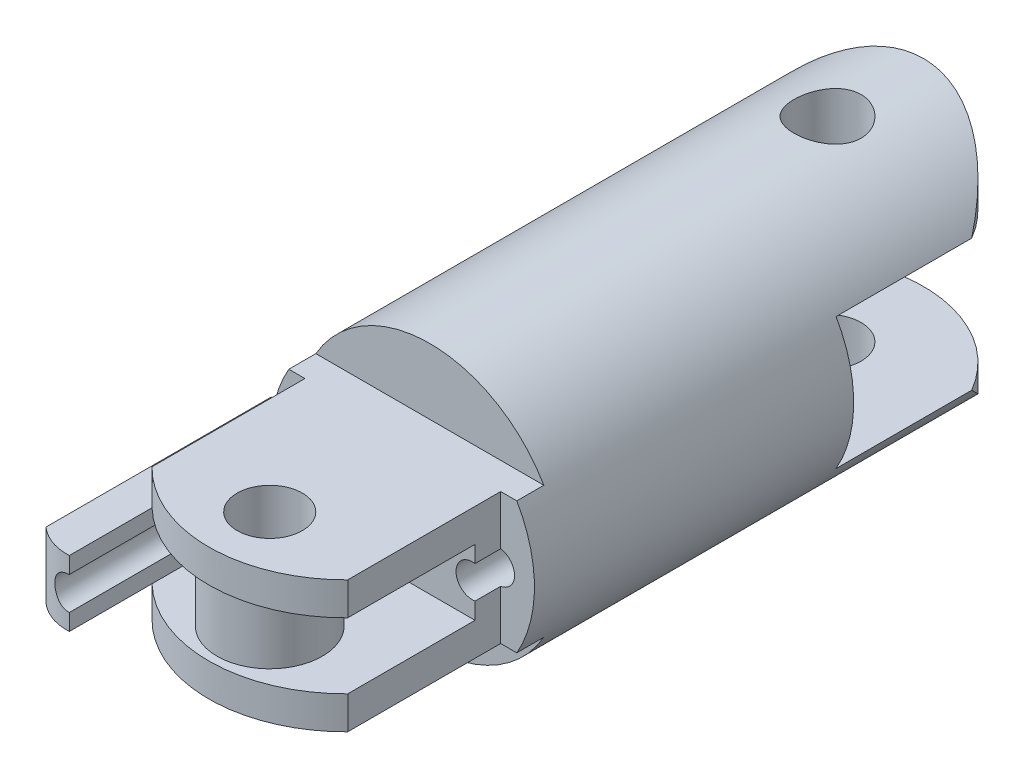
from build123d import *
from build123d.topology import SkipClean

# Parameters (mm, degrees)
SKETCH2_R                       = 10
PHALANGE_LENGTH_DEPTH           = 26.2
BOSS_EXTRUDE3_DEPTH             = 5
BOSS_EXTRUDE4_DEPTH             = 5
BOSS_EXTRUDE4_DEPTH_BACK        = 5
CUT_EXTRUDE2_START              = -15.3025
CUT_EXTRUDE2_DEPTH              = 15.3025
SKETCH7_R                       = 1.65
CUT_EXTRUDE3_DEPTH              = 10
CUT_EXTRUDE4_DEPTH              = 2.5
CUT_EXTRUDE4_DEPTH_BACK         = 2.5
CUT_EXTRUDE7_REACH              = 47.294
SKETCH4_R                       = 1.65
CUT_EXTRUDE7_DIRECTION_2_REACH  = 47.294
CUT_EXTRUDE_THIN1_START         = 26.2
CUT_EXTRUDE_THIN1_DEPTH         = 10.361670454
BOSS_EXTRUDE5_REACH             = 46.529
SKETCH9_R                       = 4
SKETCH9_R_2                     = 1.65
CUT_EXTRUDE8_REACH              = 45.846
SKETCH10_R                      = 1.25
CUT_EXTRUDE9_START              = -4
CUT_EXTRUDE9_DEPTH              = 4
CUT_EXTRUDE10_REACH             = 46.529
CUT_EXTRUDE10_DIRECTION_2_REACH = 46.529
CUT_EXTRUDE11_START             = -10
CUT_EXTRUDE11_OUTLINE_W         = 2.565773848
CUT_EXTRUDE11_OUTLINE_H         = 11.6166929
CUT_EXTRUDE11_DEPTH             = 10
BOSS_EXTRUDE7_REACH             = 44.149
CUT_EXTRUDE12_REACH             = 45.846
SKETCH10_2_R                    = 1.25
CUT_EXTRUDE12_DIRECTION_2_REACH = 45.846
SKETCH17_R                      = 1.25
SKETCH17_W                      = 2.42123439
SKETCH17_H                      = 5
CUT_EXTRUDE14_DEPTH             = 16.148519
SCALE1_SCALE                    = 0.666666667
CUT_EXTRUDE15_START             = -10.000004
SKETCH18_R                      = 1.65
CUT_EXTRUDE15_DEPTH             = 13.333342
CUT_EXTRUDE16_START             = -3.333333
SKETCH19_R                      = 1.7
CUT_EXTRUDE16_DEPTH             = 13.333338


# Read off the part's stored shape, not the designer's step: Cut-Extrude-Thin1, Cut-Extrude11
with BuildPart() as part:
    # Sketch2 → Phalange Length (new body)
    with BuildSketch(Plane.XY):
        Circle(SKETCH2_R)
    extrude(amount=PHALANGE_LENGTH_DEPTH)

    # Sketch3 → Boss-Extrude3 (add)
    with BuildSketch(Plane(origin=(0, -10, 0), x_dir=(-1, 0, 0), z_dir=(0, -1, 0))):
        with BuildLine():
            Line((-10, 5.302499701), (-10, 0))
            Line((-10, 0), (10, 0))
            Line((10, 0), (10, 5.302499701))
            ThreePointArc((10, 5.302499701), (0, 15.302499701), (-10, 5.302499701))
        make_face()
    boss_extrude3 = extrude(amount=-BOSS_EXTRUDE3_DEPTH)

    # Mirror1: Boss-Extrude3 across plane
    add(boss_extrude3.mirror(Plane.ZX))

    # Sketch5 → Boss-Extrude4 (add, two sides: drawn at the far end of the back side and taken through both)
    with BuildSketch(Plane(origin=(0, 0, 0), x_dir=(1, 0, 0), z_dir=(0, 1, 0)).offset(-BOSS_EXTRUDE4_DEPTH_BACK)):
        with BuildLine():
            Line((-10, -31.983157911), (-10, -26.2))
            Line((-10, -26.2), (10, -26.2))
            Line((10, -26.2), (10, -31.983157911))
            ThreePointArc((10, -31.983157911), (0, -41.551984156), (-10, -31.983157911))
        make_face()
    extrude(amount=BOSS_EXTRUDE4_DEPTH + BOSS_EXTRUDE4_DEPTH_BACK)

    # Sketch6 → Cut-Extrude2 (cut)
    with SkipClean():  # the faces are left unmerged after this step: merging them gives an invalid solid
        with BuildSketch(Plane.XY.offset(CUT_EXTRUDE2_START)):
            with BuildLine():
                ThreePointArc((0, 10), (5, 8.660254038), (8.660254038, 5))
                Line((8.660254038, 5), (10, 5))
                Line((10, 5), (10, 10))
                Line((10, 10), (0, 10))
            make_face()
            with BuildLine():
                Line((10, -5), (8.660254038, -5))
                ThreePointArc((8.660254038, -5), (5, -8.660254038), (0, -10))
                Line((0, -10), (10, -10))
                Line((10, -10), (10, -5))
            make_face()
            with BuildLine():
                ThreePointArc((-8.660254038, 5), (-5, 8.660254038), (0, 10))
                Line((0, 10), (-10, 10))
                Line((-10, 10), (-10, 5))
                Line((-10, 5), (-8.660254038, 5))
            make_face()
            with BuildLine():
                Line((-10, -10), (0, -10))
                ThreePointArc((0, -10), (-5, -8.660254038), (-8.660254038, -5))
                Line((-8.660254038, -5), (-10, -5))
                Line((-10, -5), (-10, -10))
            make_face()
        extrude(amount=CUT_EXTRUDE2_DEPTH, mode=Mode.SUBTRACT)

    # Sketch7 → Cut-Extrude3 (cut)
    with SkipClean():  # the faces are left unmerged after this step: merging them gives an invalid solid
        with BuildSketch(Plane(origin=(0, 5, 0), x_dir=(1, 0, 0), z_dir=(0, 1, 0))):
            with Locations(Location((0, -34.361984156, 0), (0, 0, 270))):
                Circle(SKETCH7_R)
        extrude(amount=-CUT_EXTRUDE3_DEPTH, mode=Mode.SUBTRACT)

    # Sketch5<2> → Cut-Extrude4 (cut, two sides: drawn at the far end of the back side and taken through both)
    with BuildSketch(Plane(origin=(0, 0, 0), x_dir=(1, 0, 0), z_dir=(0, 1, 0)).offset(-CUT_EXTRUDE4_DEPTH_BACK)):
        with BuildLine():
            Line((-10, -31.983157911), (-10, -26.2))
            Line((-10, -26.2), (10, -26.2))
            Line((10, -26.2), (10, -31.983157911))
            ThreePointArc((10, -31.983157911), (0, -41.551984156), (-10, -31.983157911))
        make_face()
    extrude(amount=CUT_EXTRUDE4_DEPTH + CUT_EXTRUDE4_DEPTH_BACK, mode=Mode.SUBTRACT)

    # Sketch4 → Cut-Extrude7 (cut, up to next)
    with BuildSketch(Plane(origin=(0, -5, 0), x_dir=(1, 0, 0), z_dir=(0, 1, 0)), mode=Mode.PRIVATE) as cut_extrude7_sk1:
        with Locations(Location((0, 8.010159673, 0), (0, 0, 270))):
            Circle(SKETCH4_R)
    cut_extrude7_tool1 = extrude(cut_extrude7_sk1.sketch, amount=-CUT_EXTRUDE7_REACH, mode=Mode.PRIVATE) & part.part
    add(cut_extrude7_tool1.solids().sort_by_distance((0, -5, -8.01016))[0], mode=Mode.SUBTRACT)

    # Sketch4 → Cut-Extrude7 direction 2 (cut, up to next)
    with BuildSketch(Plane(origin=(0, -5, 0), x_dir=(1, 0, 0), z_dir=(0, 1, 0)), mode=Mode.PRIVATE) as cut_extrude7_direction_2_sk1:
        with Locations(Location((0, 8.010159673, 0), (0, 0, 270))):
            Circle(SKETCH4_R)
    cut_extrude7_direction_2_tool1 = extrude(cut_extrude7_direction_2_sk1.sketch, amount=CUT_EXTRUDE7_DIRECTION_2_REACH, mode=Mode.PRIVATE) & part.part
    add(cut_extrude7_direction_2_tool1.solids().sort_by_distance((0, -5, -8.01016))[0], mode=Mode.SUBTRACT)

    # Cut-Extrude-Thin1 outline → Cut-Extrude-Thin1 (cut)
    with SkipClean():  # the faces are left unmerged after this step: merging them gives an invalid solid
        with BuildSketch(Plane.XY.offset(CUT_EXTRUDE_THIN1_START)):
            with BuildLine():
                ThreePointArc((8.660254038, 5), (9.256147934, 3.78466979), (9.682458366, 2.5))
                Line((9.682458366, 2.5), (10, 2.5))
                Line((10, 2.5), (10, 5))
                Line((10, 5), (8.660254038, 5))
            make_face()
            with BuildLine():
                Line((10, -2.5), (9.682458366, -2.5))
                ThreePointArc((9.682458366, -2.5), (9.256147934, -3.78466979), (8.660254038, -5))
                Line((8.660254038, -5), (10, -5))
                Line((10, -5), (10, -2.5))
            make_face()
            with BuildLine():
                Line((-10, 2.5), (-9.682458366, 2.5))
                ThreePointArc((-9.682458366, 2.5), (-9.256147934, 3.78466979), (-8.660254038, 5))
                Line((-8.660254038, 5), (-10, 5))
                Line((-10, 5), (-10, 2.5))
            make_face()
            with BuildLine():
                ThreePointArc((-8.660254038, -5), (-9.256147934, -3.78466979), (-9.682458366, -2.5))
                Line((-9.682458366, -2.5), (-10, -2.5))
                Line((-10, -2.5), (-10, -5))
                Line((-10, -5), (-8.660254038, -5))
            make_face()
        extrude(amount=CUT_EXTRUDE_THIN1_DEPTH, mode=Mode.SUBTRACT)

    # Sketch9 → Boss-Extrude5 (add, up to next)
    with BuildSketch(Plane.XZ.offset(-2.5), mode=Mode.PRIVATE) as boss_extrude5_sk1:
        with Locations(Location((0, 34.361984156, 0), (0, 0, 90))):
            Circle(SKETCH9_R)
        with Locations(Location((0, 34.361984156, 0), (0, 0, 90))):
            Circle(SKETCH9_R_2, mode=Mode.SUBTRACT)
    boss_extrude5_tool1 = extrude(boss_extrude5_sk1.sketch, amount=BOSS_EXTRUDE5_REACH, mode=Mode.PRIVATE) - part.part
    add(boss_extrude5_tool1.solids().sort_by_distance((0, 2.5, 30.475121))[0])

    # Sketch10 → Cut-Extrude8 (cut, up to next)
    with BuildSketch(Plane.XY.offset(26.2), mode=Mode.PRIVATE) as cut_extrude8_sk1:
        with Locations((7.239961745, 0)):
            Circle(SKETCH10_R)
    cut_extrude8_tool1 = extrude(cut_extrude8_sk1.sketch, amount=-CUT_EXTRUDE8_REACH, mode=Mode.PRIVATE) & part.part
    # Sketch10 → Cut-Extrude8 (cut, up to next)
    with BuildSketch(Plane.XY.offset(26.2), mode=Mode.PRIVATE) as cut_extrude8_sk2:
        with Locations((-7.239961745, 0)):
            Circle(SKETCH10_R)
    cut_extrude8_tool2 = extrude(cut_extrude8_sk2.sketch, amount=-CUT_EXTRUDE8_REACH, mode=Mode.PRIVATE) & part.part
    add(cut_extrude8_tool1.solids().sort_by_distance((7.239962, 0, 26.2))[0], mode=Mode.SUBTRACT)
    add(cut_extrude8_tool2.solids().sort_by_distance((-7.239962, 0, 26.2))[0], mode=Mode.SUBTRACT)

    # Sketch11 → Cut-Extrude9 (cut)
    with SkipClean():  # the faces are left unmerged after this step: merging them gives an invalid solid
        with BuildSketch(Plane.XY.offset(26.2).offset(CUT_EXTRUDE9_START)):
            with BuildLine():
                ThreePointArc((8.660254038, 5), (0, 10), (-8.660254038, 5))
                Line((-8.660254038, 5), (8.660254038, 5))
            make_face()
            with BuildLine():
                Line((8.660254038, -5), (-8.660254038, -5))
                ThreePointArc((-8.660254038, -5), (0, -10), (8.660254038, -5))
            make_face()
        extrude(amount=CUT_EXTRUDE9_DEPTH, mode=Mode.SUBTRACT)

    # Sketch12 → Cut-Extrude10 (cut, up to next)
    with BuildSketch(Plane.XZ.offset(-2.5), mode=Mode.PRIVATE) as cut_extrude10_sk1:
        with BuildLine():
            Line((-10.033719202, 41.551984156), (-10.033719202, 34.364892021))
            Line((-10.033719202, 34.364892021), (-8.660254038, 34.364892021))
            ThreePointArc((-8.660254038, 34.364892021), (0, 38.990740593), (8.660254038, 34.364892021))
            Line((8.660254038, 34.364892021), (10.033719202, 34.364892021))
            Line((10.033719202, 34.364892021), (10.033719202, 41.551984156))
            Line((10.033719202, 41.551984156), (-10.033719202, 41.551984156))
        make_face()
    cut_extrude10_tool1 = extrude(cut_extrude10_sk1.sketch, amount=CUT_EXTRUDE10_REACH, mode=Mode.PRIVATE) & part.part
    add(cut_extrude10_tool1.solids().sort_by_distance((0, 2.5, 39.050279))[0], mode=Mode.SUBTRACT)

    # Sketch12 → Cut-Extrude10 direction 2 (cut, up to next)
    with BuildSketch(Plane.XZ.offset(-2.5), mode=Mode.PRIVATE) as cut_extrude10_direction_2_sk1:
        with BuildLine():
            Line((-10.033719202, 41.551984156), (-10.033719202, 34.364892021))
            Line((-10.033719202, 34.364892021), (-8.660254038, 34.364892021))
            ThreePointArc((-8.660254038, 34.364892021), (0, 38.990740593), (8.660254038, 34.364892021))
            Line((8.660254038, 34.364892021), (10.033719202, 34.364892021))
            Line((10.033719202, 34.364892021), (10.033719202, 41.551984156))
            Line((10.033719202, 41.551984156), (-10.033719202, 41.551984156))
        make_face()
    cut_extrude10_direction_2_tool1 = extrude(cut_extrude10_direction_2_sk1.sketch, amount=-CUT_EXTRUDE10_DIRECTION_2_REACH, mode=Mode.PRIVATE) & part.part
    add(cut_extrude10_direction_2_tool1.solids().sort_by_distance((0, 2.5, 39.050279))[0], mode=Mode.SUBTRACT)

    # Cut-Extrude11 outline → Cut-Extrude11 (cut)
    with BuildSketch(Plane.XZ.offset(5).offset(CUT_EXTRUDE11_START)):
        with Locations((-8.717113076, 30.060571369)):
            Rectangle(CUT_EXTRUDE11_OUTLINE_W, CUT_EXTRUDE11_OUTLINE_H)
        with Locations((8.717113076, 30.060571369)):
            Rectangle(CUT_EXTRUDE11_OUTLINE_W, CUT_EXTRUDE11_OUTLINE_H)
    extrude(amount=CUT_EXTRUDE11_DEPTH, mode=Mode.SUBTRACT)

    # Boss-Extrude7: up to this face of the body (flat: up to its plane)
    boss_extrude7_end = Plane(part.part.faces().sort_by_distance((0, 2.5, 26.396174341))[0])
    # Sketch16 → Boss-Extrude7 (add, up to the picked face)
    with BuildSketch(Plane(origin=(0, -2.5, 0), x_dir=(1, 0, 0), z_dir=(0, 1, 0)), mode=Mode.PRIVATE) as boss_extrude7_sk1:
        with BuildLine():
            Line((-4.818727355, -24.252224919), (-7.434226152, -24.252224919))
            Line((-7.434226152, -24.252224919), (-10, -24.252224919))
            Line((-10, -24.252224919), (-10, -41.358561033))
            ThreePointArc((-10, -41.358561033), (-8.808295471, -42.090817912), (-7.43422564, -42.352145139))
            ThreePointArc((-7.43422564, -42.352145139), (-6.033645007, -42.099721533), (-4.818727355, -41.358561033))
            Line((-4.818727355, -41.358561033), (-4.818727355, -37.809527951))
            ThreePointArc((-4.818727355, -37.809527951), (-6.204248493, -36.942230104), (-7.437080645, -35.868917819))
            Line((-7.437080645, -35.868917819), (-7.434226152, -35.868917819))
            Line((-7.434226152, -35.868917819), (-7.434226152, -26.2))
            Line((-7.434226152, -26.2), (-4.818727355, -26.2))
            Line((-4.818727355, -26.2), (-4.818727355, -24.252224919))
        make_face()
    boss_extrude7_tool1 = split(extrude(boss_extrude7_sk1.sketch, amount=BOSS_EXTRUDE7_REACH, mode=Mode.PRIVATE), bisect_by=boss_extrude7_end, keep=Keep.BOTH, mode=Mode.PRIVATE)
    # Sketch16 → Boss-Extrude7 (add, up to the picked face)
    with BuildSketch(Plane(origin=(0, -2.5, 0), x_dir=(1, 0, 0), z_dir=(0, 1, 0)), mode=Mode.PRIVATE) as boss_extrude7_sk2:
        with BuildLine():
            Line((-4.818727355, -37.809527951), (-4.818727355, -26.2))
            Line((-4.818727355, -26.2), (-7.434226152, -26.2))
            Line((-7.434226152, -26.2), (-7.434226152, -35.868917819))
            Line((-7.434226152, -35.868917819), (-7.437080645, -35.868917819))
            ThreePointArc((-7.437080645, -35.868917819), (-6.204248493, -36.942230104), (-4.818727355, -37.809527951))
        make_face()
    boss_extrude7_tool2 = split(extrude(boss_extrude7_sk2.sketch, amount=BOSS_EXTRUDE7_REACH, mode=Mode.PRIVATE), bisect_by=boss_extrude7_end, keep=Keep.BOTH, mode=Mode.PRIVATE)
    add(boss_extrude7_tool1.solids().sort_by(Axis((-7.989429, -2.5, 33.833344), (0, 1, 0)))[0])
    add(boss_extrude7_tool2.solids().sort_by(Axis((-6.08748, -2.5, 31.5879), (0, 1, 0)))[0])

    # Sketch10<2> → Cut-Extrude12 (cut, up to next)
    with BuildSketch(Plane.XY.offset(26.2), mode=Mode.PRIVATE) as cut_extrude12_sk1:
        with Locations((-7.239961745, 0)):
            Circle(SKETCH10_2_R)
    cut_extrude12_tool1 = extrude(cut_extrude12_sk1.sketch, amount=CUT_EXTRUDE12_REACH, mode=Mode.PRIVATE) & part.part
    add(cut_extrude12_tool1.solids().sort_by_distance((-7.239962, 0, 26.2))[0], mode=Mode.SUBTRACT)

    # Sketch10<2> → Cut-Extrude12 direction 2 (cut, up to next)
    with BuildSketch(Plane.XY.offset(26.2), mode=Mode.PRIVATE) as cut_extrude12_direction_2_sk1:
        with Locations((-7.239961745, 0)):
            Circle(SKETCH10_2_R)
    cut_extrude12_direction_2_tool1 = extrude(cut_extrude12_direction_2_sk1.sketch, amount=-CUT_EXTRUDE12_DIRECTION_2_REACH, mode=Mode.PRIVATE) & part.part
    add(cut_extrude12_direction_2_tool1.solids().sort_by_distance((-7.239962, 0, 26.2))[0], mode=Mode.SUBTRACT)

    # Sketch17 → Cut-Extrude14 (cut)
    with SkipClean():  # the faces are left unmerged after this step: merging them gives an invalid solid
        with BuildSketch(Plane.XY.offset(26.2)):
            with Locations((-7.239961745, 0)):
                Circle(SKETCH17_R)
            with Locations((-6.02934455, 0)):
                Rectangle(SKETCH17_W, SKETCH17_H)
        extrude(amount=CUT_EXTRUDE14_DEPTH, mode=Mode.SUBTRACT)


with BuildPart() as part_1:
    # Scale1: scaled about (-0.170628715, -1.58e-07, 11.526321464)
    add(part.part.scale(SCALE1_SCALE).moved(Location((-0.056876238, -5.3e-08, 3.842107155))))

    # Sketch18 → Cut-Extrude15 (cut)
    with BuildSketch(Plane(origin=(0, 3.333328658, 0), x_dir=(1, 0, 0), z_dir=(0, 1, 0)).offset(CUT_EXTRUDE15_START)):
        with Locations(Location((-0.056884983, -26.750263395, 0), (0, 0, 270))):
            Circle(SKETCH18_R)
    extrude(amount=CUT_EXTRUDE15_DEPTH, mode=Mode.SUBTRACT)

    # Sketch19 → Cut-Extrude16 (cut)
    with BuildSketch(Plane(origin=(0, -3.333338008, 0), x_dir=(1, 0, 0), z_dir=(0, 1, 0)).offset(CUT_EXTRUDE16_START)):
        with Locations(Location((-0.056884983, 1.497832491, 0), (0, 0, 90))):
            Circle(SKETCH19_R)
    extrude(amount=CUT_EXTRUDE16_DEPTH, mode=Mode.SUBTRACT)


solid = part_1.part
